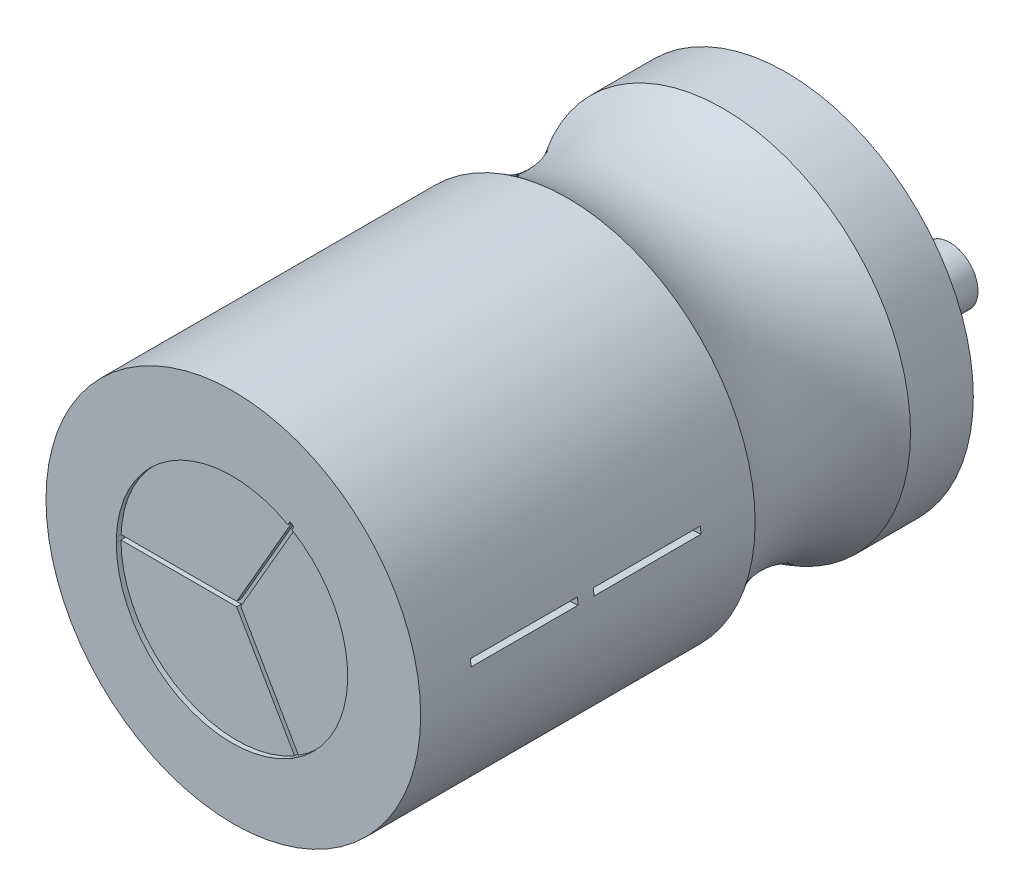
from build123d import *

# Parameters (mm, degrees)
SKETCH_1_R          = 4
EXTRUDE_1_DEPTH     = 12
SKETCH_2_R          = 6
CUT_EXTRUDE_1_DEPTH = 0.2
CUT_EXTRUDE_2_DEPTH = 0.2
SKETCH_5_R          = 0.6
EXTRUDE_2_DEPTH     = 2
SKETCH_7_R          = 2.470632437
CUT_EXTRUDE_3_DEPTH = 0.1
WRAP_START          = 5.798600642
WRAP_1_DEPTH        = 2.284722222
WRAP_START_2        = 8.423600642
WRAP_1_2_DEPTH      = 2.284722222


# Read off the part's stored shape, not the designer's step: 包覆1
with BuildPart() as part:
    # 草图1 → 凸台-拉伸1 (new body)
    with BuildSketch(Plane.XY):
        Circle(SKETCH_1_R)
    extrude(amount=EXTRUDE_1_DEPTH)

    # 草图2 → 切除-拉伸1 (cut)
    with BuildSketch(Plane.XY.offset(12)):
        Circle(SKETCH_2_R)
    extrude(amount=-CUT_EXTRUDE_1_DEPTH, mode=Mode.SUBTRACT)

    # 草图3 → 切除-拉伸2 (cut)
    with BuildSketch(Plane.XY.offset(11.8)):
        with BuildLine():
            Line((-0.04330127, 0.025), (-0.028867513, 0.05))
            Line((-0.028867513, 0.05), (-2.49949995, 0.05))
            ThreePointArc((-2.49949995, 0.05), (-2.5, 0), (-2.49949995, -0.05))
            Line((-2.49949995, -0.05), (-0.028867513, -0.05))
            Line((-0.028867513, -0.05), (-0.04330127, -0.025))
            Line((-0.04330127, -0.025), (0, 0))
            Line((0, 0), (-0.04330127, 0.025))
        make_face()
        with BuildLine():
            Line((0.04330127, -0.025), (0, 0))
            Line((0, 0), (0, -0.05))
            Line((0, -0.05), (-0.028867513, -0.05))
            Line((-0.028867513, -0.05), (1.206448705, -2.189630453))
            ThreePointArc((1.206448705, -2.189630453), (1.25, -2.165063509), (1.293051245, -2.139630453))
            Line((1.293051245, -2.139630453), (0.057735027, 0))
            Line((0.057735027, 0), (0.04330127, -0.025))
        make_face()
        with BuildLine():
            Line((-0.028867513, 0.05), (0, 0.05))
            Line((0, 0.05), (0, 0))
            Line((0, 0), (0.04330127, 0.025))
            Line((0.04330127, 0.025), (0.057735027, 0))
            Line((0.057735027, 0), (1.293051245, 2.139630453))
            ThreePointArc((1.293051245, 2.139630453), (1.25, 2.165063509), (1.206448705, 2.189630453))
            Line((1.206448705, 2.189630453), (-0.028867513, 0.05))
        make_face()
        Polygon((0, 0), (0, 0.05), (-0.028867513, 0.05), (-0.04330127, 0.025), align=None)
        Polygon((0, -0.05), (0, 0), (-0.04330127, -0.025), (-0.028867513, -0.05), align=None)
        Polygon((0.04330127, 0.025), (0, 0), (0.04330127, -0.025), (0.057735027, 0), align=None)
    extrude(amount=-CUT_EXTRUDE_2_DEPTH, mode=Mode.SUBTRACT)

    # 草图4 → 切除-旋转1 (revolve, cut)
    with BuildSketch(Plane(origin=(0, 0, 0), x_dir=(1, 0, 0), z_dir=(0, 1, 0))):
        with BuildLine():
            Line((-4.318421305, -0.940700508), (-4.318421305, -5.059299492))
            ThreePointArc((-4.318421305, -5.059299492), (-3.5, -3), (-4.318421305, -0.940700508))
        make_face()
    revolve(axis=Axis((0, 0, 0), (0, 0, 1)), mode=Mode.SUBTRACT)

    # 草图5 → 凸台-拉伸2 (add)
    with BuildSketch(Plane(origin=(0, 0, 0), x_dir=(-1, 0, 0), z_dir=(0, 0, -1))):
        with Locations(Location((1.5, 0, 0), (0, 0, 180))):
            Circle(SKETCH_5_R)
        with Locations(Location((-1.5, 0, 0), (0, 0, 180))):
            Circle(SKETCH_5_R)
    extrude(amount=EXTRUDE_2_DEPTH)

    # 草图7 → 切除-拉伸3 (cut)
    with BuildSketch(Plane.XY.offset(11.8)):
        with Locations((-0.028867513, -0.05)):
            Circle(SKETCH_7_R)
    extrude(amount=-CUT_EXTRUDE_3_DEPTH, mode=Mode.SUBTRACT)

    # 包覆1 outline → 包覆1 (cut)
    with BuildSketch(Plane.XY.offset(WRAP_START)):
        with BuildLine():
            Line((3.969650484, 0.491807924), (3.77116796, 0.467217528))
            ThreePointArc((3.77116796, 0.467217528), (3.779057907, 0.398398459), (3.785692099, 0.329447005))
            Line((3.785692099, 0.329447005), (3.984939052, 0.346786321))
            ThreePointArc((3.984939052, 0.346786321), (3.977955692, 0.419366799), (3.969650484, 0.491807924))
        make_face()
    extrude(amount=WRAP_1_DEPTH, mode=Mode.SUBTRACT)

    # Wrap 1 2 outline → Wrap 1 2 (cut)
    with BuildSketch(Plane.XY.offset(WRAP_START_2)):
        with BuildLine():
            Line((3.969650484, 0.491807924), (3.77116796, 0.467217528))
            ThreePointArc((3.77116796, 0.467217528), (3.779057907, 0.398398459), (3.785692099, 0.329447005))
            Line((3.785692099, 0.329447005), (3.984939052, 0.346786321))
            ThreePointArc((3.984939052, 0.346786321), (3.977955692, 0.419366799), (3.969650484, 0.491807924))
        make_face()
    extrude(amount=WRAP_1_2_DEPTH, mode=Mode.SUBTRACT)


solid = part.part
